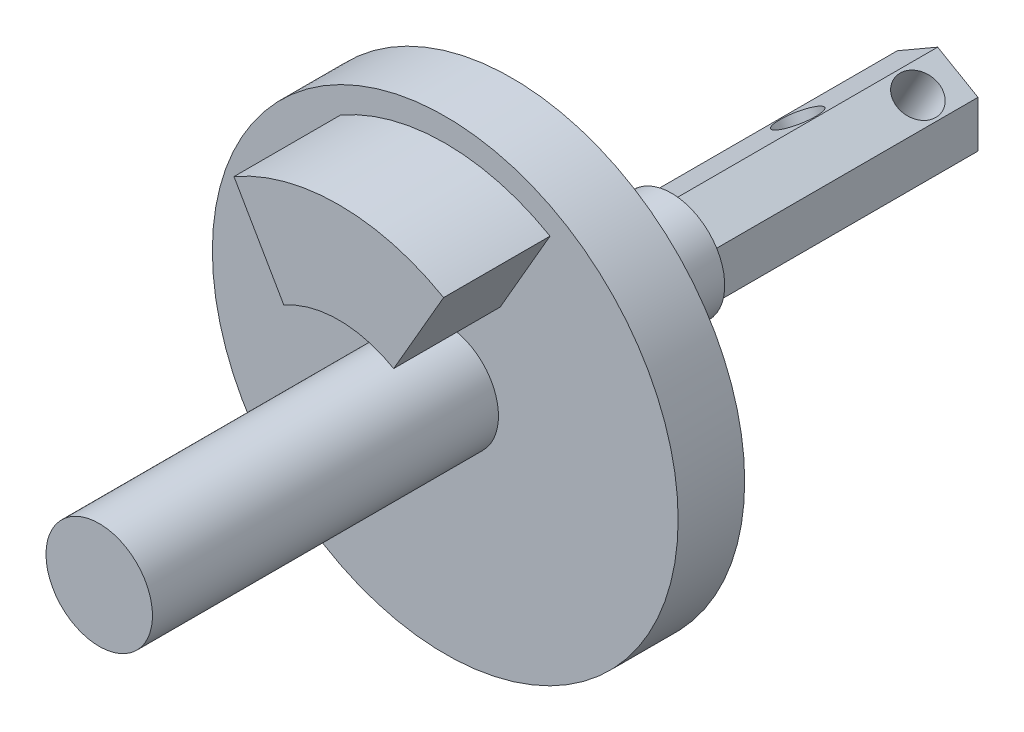
from build123d import *

# Parameters (mm, degrees)
SKETCH1_R           = 17.5
BOSS_EXTRUDE1_DEPTH = 2.5
BOSS_EXTRUDE2_DEPTH = 8
SKETCH3_R           = 4
BOSS_EXTRUDE3_DEPTH = 26
BOSS_EXTRUDE4_START = 12
SKETCH7_R           = 4
BOSS_EXTRUDE4_DEPTH = 12
BOSS_EXTRUDE5_DEPTH = 20
SKETCH10_R          = 1.55
CUT_EXTRUDE1_DEPTH  = 6.1
SKETCH11_R          = 1.55
CUT_EXTRUDE4_DEPTH  = 6.1


with BuildPart() as part:
    # Sketch1 → Boss-Extrude1 (new, symmetric)
    with BuildSketch(Plane.XY):
        Circle(SKETCH1_R)
    extrude(amount=BOSS_EXTRUDE1_DEPTH, both=True)

    # Sketch2 → Boss-Extrude2 (add)
    with BuildSketch(Plane.XY.offset(2.5)):
        with BuildLine():
            Line((7.875, 13.63990011), (4.125, 7.144709581))
            ThreePointArc((4.125, 7.144709581), (0, 8.25), (-4.125, 7.144709581))
            Line((-4.125, 7.144709581), (-7.875, 13.63990011))
            ThreePointArc((-7.875, 13.63990011), (0, 15.75), (7.875, 13.63990011))
        make_face()
    extrude(amount=BOSS_EXTRUDE2_DEPTH)

    # Sketch3 → Boss-Extrude3 (add)
    with BuildSketch(Plane.XY.offset(2.5)):
        Circle(SKETCH3_R)
    extrude(amount=BOSS_EXTRUDE3_DEPTH)

    # Sketch7 → Boss-Extrude4 (add)
    with BuildSketch(Plane(origin=(0, 0, -2.5), x_dir=(-1, 0, 0), z_dir=(0, 0, -1)).offset(BOSS_EXTRUDE4_START)):
        Circle(SKETCH7_R)
    extrude(amount=-BOSS_EXTRUDE4_DEPTH)

    # Sketch9 → Boss-Extrude5 (add)
    with BuildSketch(Plane(origin=(0, 0, -14.5), x_dir=(-1, 0, 0), z_dir=(0, 0, -1))):
        Polygon((0, 3.5), (-3.031088913, 1.75), (-3.031088913, -1.75), (0, -3.5), (3.031088913, -1.75), (3.031088913, 1.75), align=None)
    extrude(amount=BOSS_EXTRUDE5_DEPTH)

    # Sketch10 → Cut-Extrude1 (cut)
    with BuildSketch(Plane(origin=(-1.515544457, -2.625, 0), x_dir=(0.866025403784435, -0.5000000000000062, 0), z_dir=(-0.5000000000000062, -0.866025403784435, 0))):
        with Locations((0, -31.5)):
            Circle(SKETCH10_R)
    extrude(amount=-CUT_EXTRUDE1_DEPTH, mode=Mode.SUBTRACT)

    # Sketch11 → Cut-Extrude4 (cut)
    with BuildSketch(Plane(origin=(1.515544457, -2.625, 0), x_dir=(0, 0, 1), z_dir=(-0.49999999999999717, 0.8660254037844404, 0))):
        with Locations((-25.5, 0)):
            Circle(SKETCH11_R)
    extrude(amount=CUT_EXTRUDE4_DEPTH, mode=Mode.SUBTRACT)


solid = part.part
